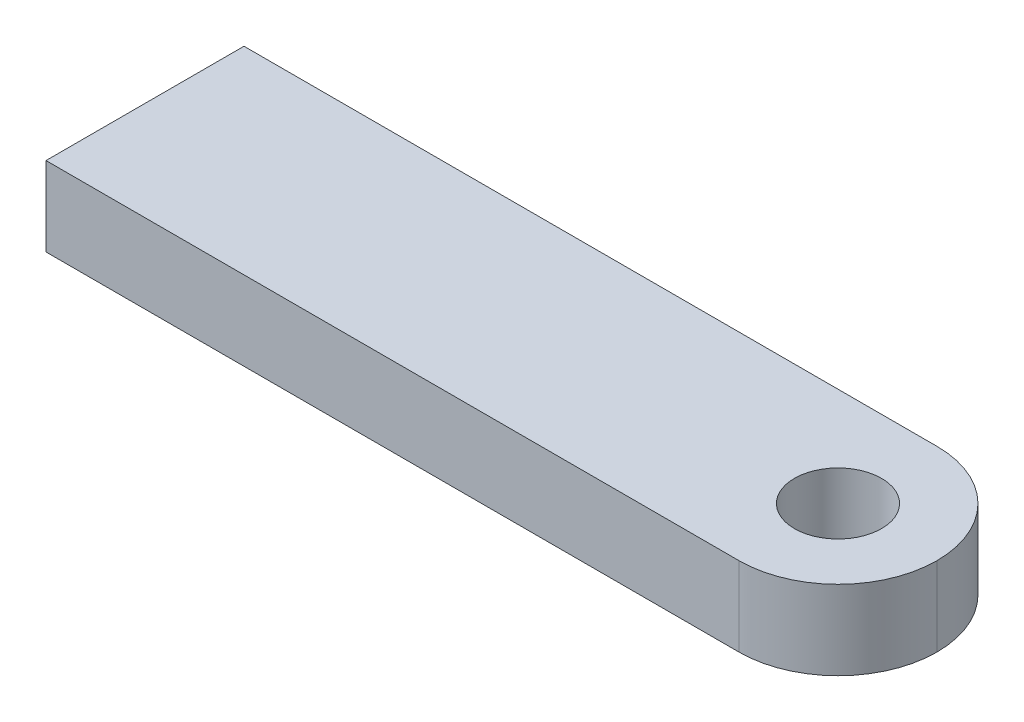
from build123d import *

# Parameters (mm, degrees)
SKETCH1_W           = 20
SKETCH1_H           = 5
BOSS_EXTRUDE1_DEPTH = 2
SKETCH2_R           = 1.1
CUT_EXTRUDE1_DEPTH  = 2
FILLET1_R           = 2.5


with BuildPart() as part:
    # Sketch1 → Boss-Extrude1 (new body)
    with BuildSketch(Plane(origin=(0, 0, 0), x_dir=(1, 0, 0), z_dir=(0, 1, 0))):
        Rectangle(SKETCH1_W, SKETCH1_H)
    extrude(amount=BOSS_EXTRUDE1_DEPTH)

    # Sketch2 → Cut-Extrude1 (cut)
    with BuildSketch(Plane(origin=(0, 2, 0), x_dir=(1, 0, 0), z_dir=(0, 1, 0))):
        with Locations(Location((7.5, 0, 0), (0, 0, 270))):
            Circle(SKETCH2_R)
    extrude(amount=-CUT_EXTRUDE1_DEPTH, mode=Mode.SUBTRACT)

    # Fillet1
    fillet1_edges = [part.edges().sort_by_distance(p)[0] for p in [
        (10, 1, 2.5),
        (10, 1, -2.5),
    ]]
    fillet(fillet1_edges, radius=FILLET1_R - 0.0001)  # a hair under: the kernel refuses the full size


solid = part.part
